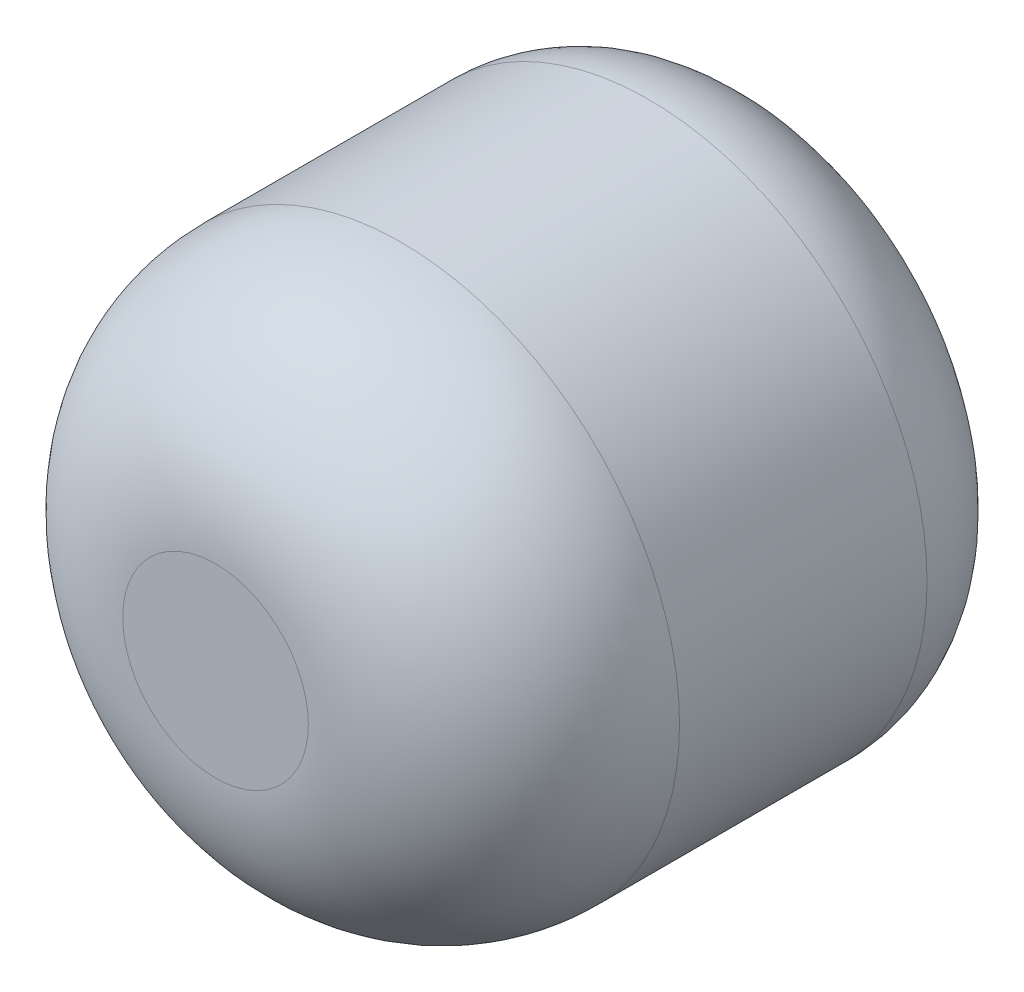
from build123d import *

# Parameters (mm, degrees)
SKETCH1_R           = 4.5
SKETCH1_R_2         = 2.4
BOSS_EXTRUDE1_DEPTH = 9
FILLET1_R           = 3
FILLET2_R           = 2
SKETCH1_4_R         = 2.4
CUT_EXTRUDE2_DEPTH  = 6


with BuildPart() as part:
    # Sketch1 → Boss-Extrude1 (new body)
    # profile 1 of 2: a face of its own
    with BuildSketch(Plane.XY):
        Circle(SKETCH1_R)
        Circle(SKETCH1_R_2, mode=Mode.SUBTRACT)
    # profile 2 of 2: a face of its own
    with BuildSketch(Plane.XY):
        Circle(SKETCH1_R_2)
    extrude(amount=BOSS_EXTRUDE1_DEPTH)

    # Fillet1
    fillet1_edges = [part.edges().sort_by_distance(p)[0] for p in [
        (-4.5, 0, 9),
    ]]
    fillet(fillet1_edges, radius=FILLET1_R)

    # Fillet2
    fillet2_edges = [part.edges().sort_by_distance(p)[0] for p in [
        (-4.5, 0, 0),
    ]]
    fillet(fillet2_edges, radius=FILLET2_R)

    # Sketch1<4> → Cut-Extrude2 (cut, symmetric)
    with BuildSketch(Plane.XY):
        Circle(SKETCH1_4_R)
    extrude(amount=CUT_EXTRUDE2_DEPTH, both=True, mode=Mode.SUBTRACT)

    # Chamfer1: read off the stored shape, not the designer's step
    # Chamfer1 outline → Chamfer1 (revolve, cut)
    with BuildSketch(Plane.XZ):
        Polygon((2.4, 0.554316771), (2.4, 0), (3.033333333, 0), (3.033333333, 0.072422361), align=None)
    revolve(axis=Axis((0, 0, 0), (0, 0, 1)), mode=Mode.SUBTRACT)


solid = part.part
